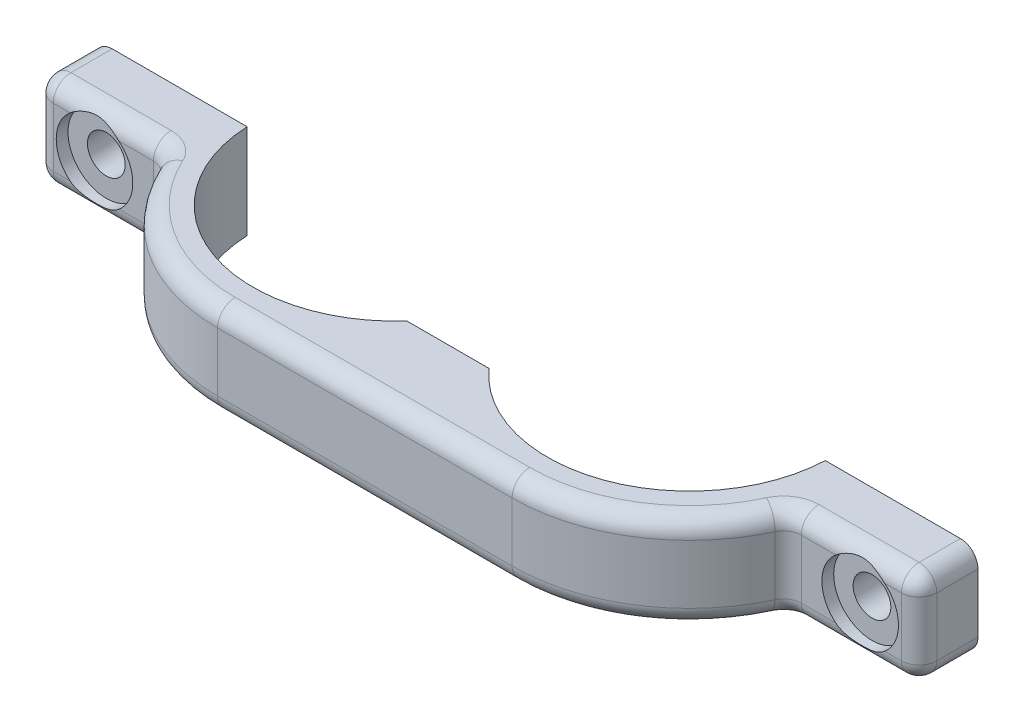
from build123d import *

# Parameters (mm, degrees)
BOSS_EXTRU_1_DEPTH      = 8
ESQUISSE2_R             = 1.6
ENL_V_MAT_EXTRU_1_DEPTH = 42.011614209
ENL_V_START             = -4
ESQUISSE3_R             = 3.25
ENL_V_MAT_EXTRU_2_DEPTH = 38.011614209
CONG_1_R                = 1.5


with BuildPart() as part:
    # Esquisse1 → Boss.-Extru.1 (new body)
    with BuildSketch(Plane(origin=(0, 0, 0), x_dir=(1, 0, 0), z_dir=(0, 1, 0))):
        with BuildLine():
            Line((-37.5, -0.5), (-24.539622087, -0.5))
            ThreePointArc((-24.539622087, -0.5), (-16.544164933, -11.351089375), (-3.488757022, -8))
            Line((-3.488757022, -8), (3.488757022, -8))
            ThreePointArc((3.488757022, -8), (16.544164933, -11.351089375), (24.539622087, -0.5))
            Line((24.539622087, -0.5), (37.5, -0.5))
            Line((37.5, -0.5), (37.5, -5.5))
            Line((37.5, -5.5), (26.509014955, -5.5))
            ThreePointArc((26.509014955, -5.5), (20.977248964, -12.435382986), (12.5, -15.05))
            Line((12.5, -15.05), (-12.5, -15.05))
            ThreePointArc((-12.5, -15.05), (-20.977248964, -12.435382986), (-26.509014955, -5.5))
            Line((-26.509014955, -5.5), (-37.5, -5.5))
            Line((-37.5, -5.5), (-37.5, -0.5))
        make_face()
    extrude(amount=BOSS_EXTRU_1_DEPTH)

    # Esquisse2 → Enlèv. mat.-Extru.1 (cut, through all)
    with BuildSketch(Plane(origin=(0, 0, 0.5), x_dir=(-1, 0, 0), z_dir=(0, 0, -1))):
        with Locations((32.5, 4)):
            Circle(ESQUISSE2_R)
        with Locations((-32.5, 4)):
            Circle(ESQUISSE2_R)
    extrude(amount=-ENL_V_MAT_EXTRU_1_DEPTH, mode=Mode.SUBTRACT)

    # Esquisse3 → Enlèv. mat.-Extru.2 (cut, through all)
    with BuildSketch(Plane(origin=(0, 0, 0.5), x_dir=(-1, 0, 0), z_dir=(0, 0, -1)).offset(ENL_V_START)):
        with Locations((32.5, 4)):
            Circle(ESQUISSE3_R)
        with Locations((-32.5, 4)):
            Circle(ESQUISSE3_R)
    extrude(amount=-ENL_V_MAT_EXTRU_2_DEPTH, mode=Mode.SUBTRACT)

    # Congé1
    # the kernel refuses this fillet: 1.5 mm, written as the material it adds along each edge
    with BuildSketch(Plane(origin=(26.509014955, 0, 5.5), x_dir=(-0.3943977660181821, 0, 0.9189398251027471), z_dir=(0, 1, 0))) as cong_1_piece_1:
        with BuildLine():
            CenterArc((0.988849381, 1.499265395), CONG_1_R, 203.228419566, 64.978347937)
            Line((-0.389560356, 0.907668746), (0, 0))
            ThreePointArc((0, 0), (0.470955164, 0.007370535), (0.941910328, 0))
        make_face()
    extrude(amount=8)
    with BuildSketch(Plane(origin=(-26.509014955, 0, 5.5), x_dir=(0.3943977660181821, 0, 0.9189398251027471), z_dir=(0, 1, 0))) as cong_1_piece_2:
        with BuildLine():
            CenterArc((0.988849381, -1.499265395), CONG_1_R, 91.793232497, 64.978347937)
            Line((-0.389560356, -0.907668746), (0, 0))
            ThreePointArc((0, 0), (0.470955164, -0.007370535), (0.941910328, 0))
        make_face()
    extrude(amount=8)
    # the kernel refuses this fillet: 1.5 mm, written as the material it takes off along each edge
    with BuildSketch(Plane(origin=(37.5, 0, -3.25), x_dir=(-1, 0, 0), z_dir=(0, 0, 1)), Plane(origin=(-37.5, 0, 9.25), x_dir=(1, 0, 0), z_dir=(0, 0, -1))) as cong_1_2_piece_1:
        with BuildLine():
            CenterArc((CONG_1_R, -CONG_1_R), CONG_1_R, 90, 90)
            Line((0, -CONG_1_R), (0, 0))
            Line((0, 0), (CONG_1_R, 0))
        make_face()
    extrude(amount=12.5, mode=Mode.SUBTRACT)
    with BuildSketch(Plane(origin=(-37.5, 8, 9.25), x_dir=(1, 0, 0), z_dir=(0, 0, -1)), Plane(origin=(37.5, 8, -3.25), x_dir=(-1, 0, 0), z_dir=(0, 0, 1))) as cong_1_2_piece_2:
        with BuildLine():
            CenterArc((CONG_1_R, CONG_1_R), CONG_1_R, 180, 90)
            Line((0, CONG_1_R), (0, 0))
            Line((0, 0), (CONG_1_R, 0))
        make_face()
    extrude(amount=12.5, mode=Mode.SUBTRACT)
    with BuildSketch(Plane(origin=(37.5, -3.75, 5.5), x_dir=(0, 0, -1), z_dir=(0, 1, 0)), Plane(origin=(-37.5, -3.75, 5.5), x_dir=(1, 0, 0), z_dir=(0, 1, 0))) as cong_1_2_piece_3:
        with BuildLine():
            CenterArc((CONG_1_R, CONG_1_R), CONG_1_R, 180, 90)
            Line((0, CONG_1_R), (0, 0))
            Line((0, 0), (CONG_1_R, 0))
        make_face()
    extrude(amount=15.5, mode=Mode.SUBTRACT)
    # the kernel refuses this fillet: 1.5 mm, written as the material it takes off along each edge
    with BuildSketch(Plane(origin=(36, 6.5, 4), x_dir=(0, 0, 1), z_dir=(0, 1, 0))) as cong_1_3_piece_1_section:
        Polygon((0, 0), (CONG_1_R, 0), (CONG_1_R, CONG_1_R), (0, CONG_1_R), align=None)
    cong_1_3_piece_1 = extrude(amount=CONG_1_R, mode=Mode.PRIVATE)
    cong_1_3_piece_1 = cong_1_3_piece_1 - Plane(origin=(36, 6.5, 4), x_dir=(-0.7071067811865475, 0, -0.7071067811865475), z_dir=(0, 1, 0)) * Sphere(CONG_1_R, mode=Mode.PRIVATE)
    add(cong_1_3_piece_1, mode=Mode.SUBTRACT)
    with BuildSketch(Plane(origin=(-36, 6.5, 4), x_dir=(0, 0, 1), z_dir=(0, 1, 0))) as cong_1_3_piece_2_section:
        Polygon((0, 0), (CONG_1_R, 0), (CONG_1_R, -CONG_1_R), (0, -CONG_1_R), align=None)
    cong_1_3_piece_2 = extrude(amount=CONG_1_R, mode=Mode.PRIVATE)
    cong_1_3_piece_2 = cong_1_3_piece_2 - Plane(origin=(-36, 6.5, 4), x_dir=(0.7071067811865475, 0, -0.7071067811865475), z_dir=(0, 1, 0)) * Sphere(CONG_1_R, mode=Mode.PRIVATE)
    add(cong_1_3_piece_2, mode=Mode.SUBTRACT)
    with BuildSketch(Plane(origin=(-36, 1.5, 4), x_dir=(0, 0, 1), z_dir=(0, -1, 0))) as cong_1_3_piece_3_section:
        Polygon((0, 0), (CONG_1_R, 0), (CONG_1_R, CONG_1_R), (0, CONG_1_R), align=None)
    cong_1_3_piece_3 = extrude(amount=CONG_1_R, mode=Mode.PRIVATE)
    cong_1_3_piece_3 = cong_1_3_piece_3 - Plane(origin=(-36, 1.5, 4), x_dir=(0.7071067811865475, 0, -0.7071067811865475), z_dir=(0, -1, 0)) * Sphere(CONG_1_R, mode=Mode.PRIVATE)
    add(cong_1_3_piece_3, mode=Mode.SUBTRACT)
    with BuildSketch(Plane(origin=(36, 1.5, 4), x_dir=(0, 0, 1), z_dir=(0, -1, 0))) as cong_1_3_piece_4_section:
        Polygon((0, 0), (CONG_1_R, 0), (CONG_1_R, -CONG_1_R), (0, -CONG_1_R), align=None)
    cong_1_3_piece_4 = extrude(amount=CONG_1_R, mode=Mode.PRIVATE)
    cong_1_3_piece_4 = cong_1_3_piece_4 - Plane(origin=(36, 1.5, 4), x_dir=(-0.7071067811865475, 0, -0.7071067811865475), z_dir=(0, -1, 0)) * Sphere(CONG_1_R, mode=Mode.PRIVATE)
    add(cong_1_3_piece_4, mode=Mode.SUBTRACT)
    with BuildSketch(Plane(origin=(36, 0, 5.5), x_dir=(0, 0, -1), z_dir=(-1, 0, 0)), Plane(origin=(-27.496749648, 0, 5.5), x_dir=(0, 0, -1), z_dir=(-1, 0, 0))) as cong_1_3_piece_5:
        with BuildLine():
            CenterArc((CONG_1_R, -CONG_1_R), CONG_1_R, 90, 90)
            Line((0, -CONG_1_R), (0, 0))
            Line((0, 0), (CONG_1_R, 0))
        make_face()
    extrude(amount=8.503250352, mode=Mode.SUBTRACT)
    with BuildSketch(Plane(origin=(12.5, 0, 0), x_dir=(0.9061480149752484, 0, 0.4229607250755286), z_dir=(0.4229607250755286, 0, -0.9061480149752484))) as cong_1_3_piece_6:
        with BuildLine():
            CenterArc((15.05 - CONG_1_R, -CONG_1_R), CONG_1_R, 0, 90)
            Line((15.05 - CONG_1_R, 0), (15.05, 0))
            Line((15.05, 0), (15.05, -CONG_1_R))
        make_face()
    revolve(axis=Axis((12.5, 0, 0), (0, -1, 0)), revolution_arc=64.978347937, mode=Mode.SUBTRACT)
    with BuildSketch(Plane(origin=(12.5, 0, 15.05), x_dir=(0, 0, -1), z_dir=(-1, 0, 0)), Plane(origin=(12.5, 8, 15.05), x_dir=(0, -1, 0), z_dir=(-1, 0, 0))) as cong_1_3_piece_7:
        with BuildLine():
            CenterArc((CONG_1_R, -CONG_1_R), CONG_1_R, 90, 90)
            Line((0, -CONG_1_R), (0, 0))
            Line((0, 0), (CONG_1_R, 0))
        make_face()
    extrude(amount=25, mode=Mode.SUBTRACT)
    with BuildSketch(Plane(origin=(-12.5, 0, 0), x_dir=(0, 0, 1), z_dir=(1, 0, 0))) as cong_1_3_piece_8:
        with BuildLine():
            CenterArc((15.05 - CONG_1_R, -CONG_1_R), CONG_1_R, 0, 90)
            Line((15.05, -CONG_1_R), (15.05, 0))
            Line((15.05, 0), (15.05 - CONG_1_R, 0))
        make_face()
    revolve(axis=Axis((-12.5, 0, 0), (0, -1, 0)), revolution_arc=64.978347937, mode=Mode.SUBTRACT)
    with BuildSketch(Plane(origin=(-27.496749648, 8, 5.5), x_dir=(0, 0, -1), z_dir=(-1, 0, 0)), Plane(origin=(36, 8, 5.5), x_dir=(0, 0, -1), z_dir=(-1, 0, 0))) as cong_1_3_piece_9:
        with BuildLine():
            CenterArc((CONG_1_R, CONG_1_R), CONG_1_R, 180, 90)
            Line((0, CONG_1_R), (0, 0))
            Line((0, 0), (CONG_1_R, 0))
        make_face()
    extrude(amount=8.503250352, mode=Mode.SUBTRACT)
    with BuildSketch(Plane(origin=(-12.5, 8, 0), x_dir=(0, 0, 1), z_dir=(1, 0, 0))) as cong_1_3_piece_10:
        with BuildLine():
            CenterArc((15.05 - CONG_1_R, CONG_1_R), CONG_1_R, 270, 90)
            Line((15.05, CONG_1_R), (15.05, 0))
            Line((15.05, 0), (15.05 - CONG_1_R, 0))
        make_face()
    revolve(axis=Axis((-12.5, 8, 0), (0, -1, 0)), revolution_arc=64.978347937, mode=Mode.SUBTRACT)
    with BuildSketch(Plane(origin=(12.5, 8, 0), x_dir=(0.9061480149752484, 0, 0.4229607250755286), z_dir=(0.4229607250755286, 0, -0.9061480149752484))) as cong_1_3_piece_11:
        with BuildLine():
            CenterArc((15.05 - CONG_1_R, CONG_1_R), CONG_1_R, 270, 90)
            Line((15.05 - CONG_1_R, 0), (15.05, 0))
            Line((15.05, 0), (15.05, CONG_1_R))
        make_face()
    revolve(axis=Axis((12.5, 8, 0), (0, -1, 0)), revolution_arc=64.978347937, mode=Mode.SUBTRACT)
    with BuildSketch(Plane(origin=(27.496749648, 8, 7), x_dir=(-0.9061480149752484, 0, -0.4229607250755287), z_dir=(-0.4229607250755287, 0, 0.9061480149752484))) as cong_1_3_piece_12:
        with BuildLine():
            CenterArc((1.5 + CONG_1_R, CONG_1_R), CONG_1_R, 180, 90)
            Line((1.5, CONG_1_R), (1.5, 0))
            Line((1.5, 0), (1.5 + CONG_1_R, 0))
        make_face()
    revolve(axis=Axis((27.496749648, 8, 7), (0, -1, 0)), revolution_arc=64.978347937, mode=Mode.SUBTRACT)
    with BuildSketch(Plane(origin=(-27.496749648, 8, 7), x_dir=(0.9061480149752487, 0, -0.42296072507552823), z_dir=(0.42296072507552823, 0, 0.9061480149752487))) as cong_1_3_piece_13:
        with BuildLine():
            CenterArc((1.5 + CONG_1_R, -CONG_1_R), CONG_1_R, 90, 90)
            Line((1.5, -CONG_1_R), (1.5, 0))
            Line((1.5, 0), (1.5 + CONG_1_R, 0))
        make_face()
    revolve(axis=Axis((-27.496749648, 8, 7), (0, 1, 0)), revolution_arc=64.978347937, mode=Mode.SUBTRACT)
    with BuildSketch(Plane(origin=(-27.496749648, 0, 7), x_dir=(0.9061480149752487, 0, -0.42296072507552823), z_dir=(0.42296072507552823, 0, 0.9061480149752487))) as cong_1_3_piece_14:
        with BuildLine():
            CenterArc((1.5 + CONG_1_R, CONG_1_R), CONG_1_R, 180, 90)
            Line((1.5, CONG_1_R), (1.5, 0))
            Line((1.5, 0), (1.5 + CONG_1_R, 0))
        make_face()
    revolve(axis=Axis((-27.496749648, 0, 7), (0, 1, 0)), revolution_arc=64.978347937, mode=Mode.SUBTRACT)
    with BuildSketch(Plane(origin=(27.496749648, 0, 7), x_dir=(-0.9061480149752484, 0, -0.4229607250755287), z_dir=(-0.4229607250755287, 0, 0.9061480149752484))) as cong_1_3_piece_15:
        with BuildLine():
            CenterArc((1.5 + CONG_1_R, -CONG_1_R), CONG_1_R, 90, 90)
            Line((1.5, -CONG_1_R), (1.5, 0))
            Line((1.5, 0), (1.5 + CONG_1_R, 0))
        make_face()
    revolve(axis=Axis((27.496749648, 0, 7), (0, -1, 0)), revolution_arc=64.978347937, mode=Mode.SUBTRACT)


solid = part.part
